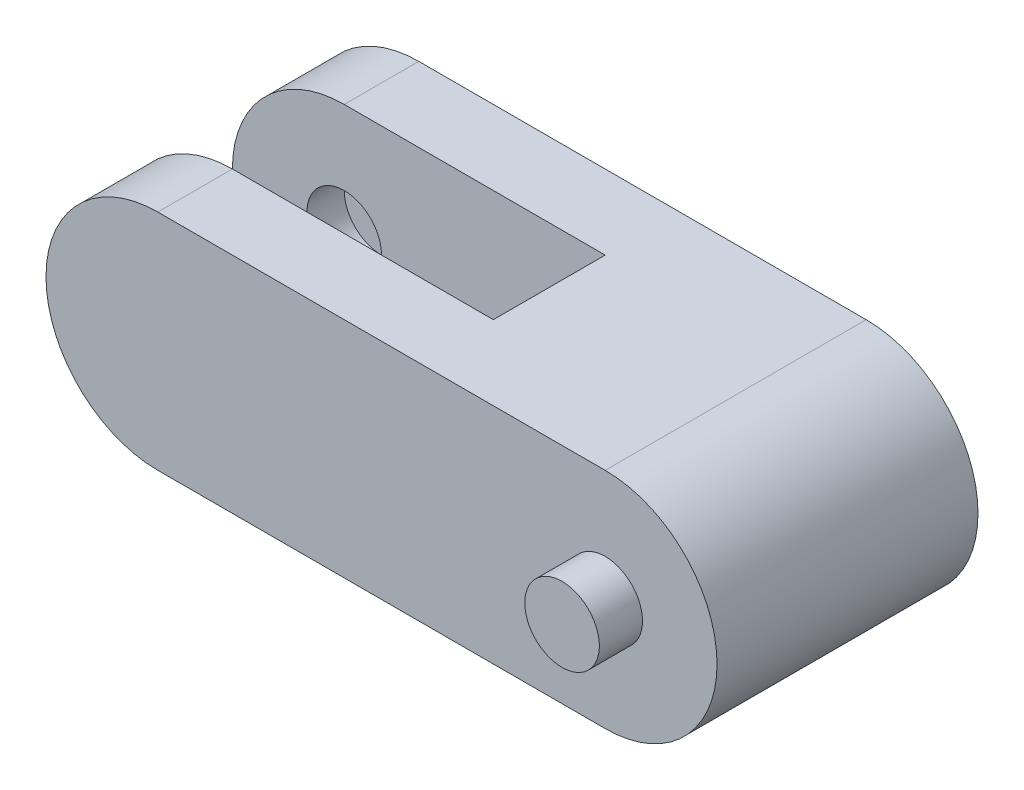
from build123d import *

# Parameters (mm, degrees)
BOSS_EXTRUDE1_DEPTH = 44.45
SKETCH3_R           = 12.7
BOSS_EXTRUDE2_DEPTH = 14.7
CUT_EXTRUDE1_DEPTH  = 19.05
SKETCH7_R           = 12.7
CUT_EXTRUDE2_DEPTH  = 12.7


with BuildPart() as part:
    # Sketch2 → Boss-Extrude1 (new, symmetric)
    with BuildSketch(Plane.XY):
        with BuildLine():
            Line((-76.2, 38.1), (76.2, 38.1))
            ThreePointArc((76.2, 38.1), (114.3, 0), (76.2, -38.1))
            Line((76.2, -38.1), (-76.2, -38.1))
            ThreePointArc((-76.2, -38.1), (-114.3, 0), (-76.2, 38.1))
        make_face()
    extrude(amount=BOSS_EXTRUDE1_DEPTH, both=True)

    # Sketch3 → Boss-Extrude2 (add)
    with BuildSketch(Plane(origin=(0, 0, -44.45), x_dir=(-1, 0, 0), z_dir=(0, 0, -1))):
        with Locations((-76.2, 0)):
            Circle(SKETCH3_R)
    boss_extrude2 = extrude(amount=BOSS_EXTRUDE2_DEPTH)

    # Mirror1: Boss-Extrude2 across plane
    add(boss_extrude2.mirror(Plane.XY))

    # Sketch5 → Cut-Extrude1 (cut, symmetric)
    with BuildSketch(Plane.XY):
        with BuildLine():
            Line((-76.2, 38.1), (12.7, 38.1))
            Line((12.7, 38.1), (12.7, -38.1))
            Line((12.7, -38.1), (-76.2, -38.1))
            ThreePointArc((-76.2, -38.1), (-114.3, 0), (-76.2, 38.1))
        make_face()
    extrude(amount=CUT_EXTRUDE1_DEPTH, both=True, mode=Mode.SUBTRACT)

    # Sketch7 → Cut-Extrude2 (cut)
    with BuildSketch(Plane.XY.offset(-19.05)):
        with Locations((-76.2, 0)):
            Circle(SKETCH7_R)
    cut_extrude2 = extrude(amount=-CUT_EXTRUDE2_DEPTH, mode=Mode.SUBTRACT)

    # Mirror2: Cut-Extrude2 across plane
    add(cut_extrude2.mirror(Plane.XY), mode=Mode.SUBTRACT)


solid = part.part
